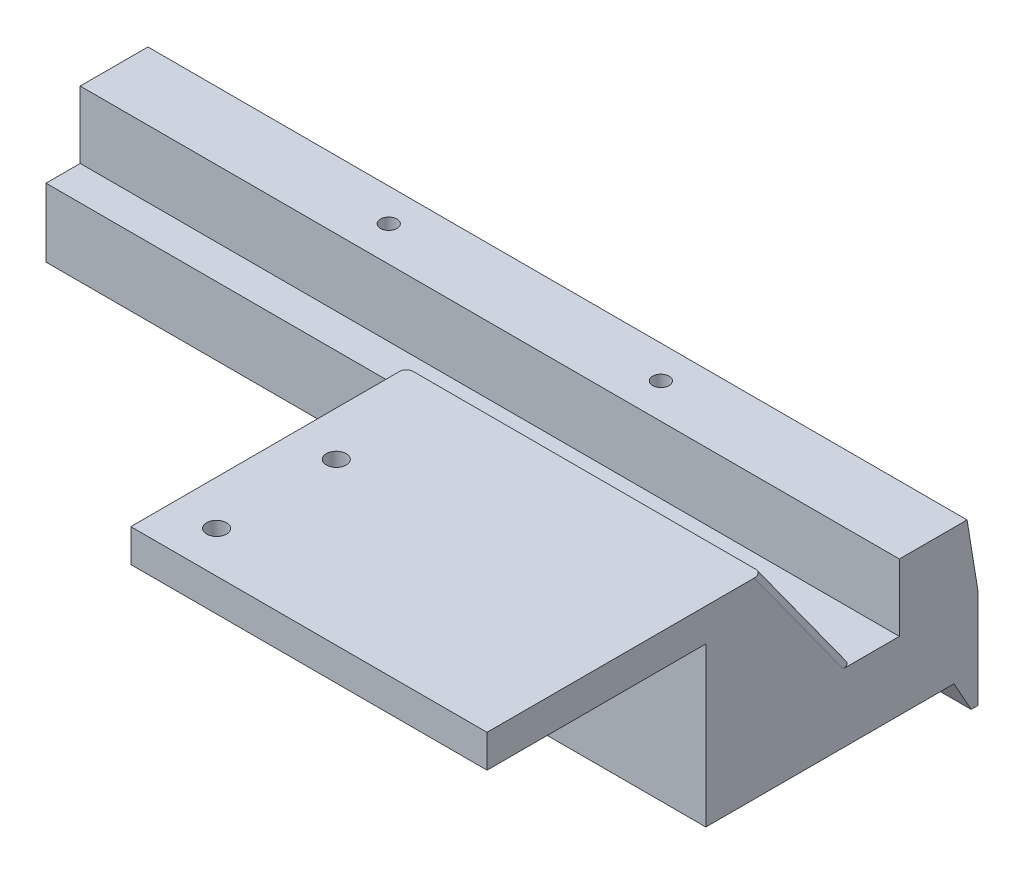
from build123d import *

# Parameters (mm, degrees)
SZKIC1_W                                             = 119.8
SZKIC1_H                                             = 10
DODANIE_WYCI_GNI_CIE2_DEPTH                          = 38.3
SZKIC21_W                                            = 119.8
SZKIC21_H                                            = 10
DODANIE_WYCI_GNI_CIE3_DEPTH                          = 9.8
POG_BIENIE_WALCOWE_POD_M2_WKR_T_DO_CZ_CI_D           = 2.4
POG_BIENIE_WALCOWE_POD_M2_WKR_T_DO_CZ_CI_CBORE_D     = 5
POG_BIENIE_WALCOWE_POD_M2_WKR_T_DO_CZ_CI_CBORE_DEPTH = 1.6
SZKIC28_R                                            = 11.1
WYTNIJ_WYCI_GNI_CIE1_DEPTH                           = 7.2
WYTNIJ_WYCI_GNI_CIE4_DEPTH                           = 124.8
DODANIE_WYCI_GNI_CIE5_DEPTH                          = 119.8
SZKIC34_W                                            = 119.8
SZKIC34_H                                            = 10
DODANIE_WYCI_GNI_CIE6_DEPTH                          = 1.5
SZKIC37_W                                            = 52.1
SZKIC37_H                                            = 8.3
DODANIE_WYCI_GNI_CIE8_DEPTH                          = 18
SZKIC38_W                                            = 52.1
SZKIC38_H                                            = 4.8
DODANIE_WYCI_GNI_CIE11_DEPTH                         = 32
ZAOKR_GLENIE5_R                                      = 0.5
SZYK_LINIOWY2_COUNT                                  = 2
SZYK_LINIOWY2_PITCH                                  = 24.2
ZAOKR_GLENIE5_OF_SZYK_LINIOWY2_R                     = 0.5
OTW_R_POD_RUB_M2_51_D                                = 2.9
EBRO7_REACH                                          = 149.637
SZKIC52_WALL_W                                       = 319.477141382
SZKIC52_WALL_H                                       = 3
ZAOKR_GLENIE7_R                                      = 1
SZYK_LINIOWY6_COUNT                                  = 5
SZYK_LINIOWY6_PITCH                                  = 12.25
ZAOKR_GLENIE7_OF_SZYK_LINIOWY6_R                     = 1
ZAOKR_GLENIE8_R                                      = 1
SZKIC53_W                                            = 67.7
SZKIC53_H                                            = 10
WYTNIJ_WYCI_GNI_CIE5_DEPTH                           = 23.3
DODANIE_WYCI_GNI_CIE12_DEPTH                         = 119.8


with BuildPart() as part:
    # Szkic1 → Dodanie-wyciągnięcie2 (new body)
    with BuildSketch(Plane.XY):
        with Locations((1.59336777, 27.024849398)):
            Rectangle(SZKIC1_W, SZKIC1_H)
    extrude(amount=DODANIE_WYCI_GNI_CIE2_DEPTH)

    # Szkic21 → Dodanie-wyciągnięcie3 (add)
    with BuildSketch(Plane(origin=(0, 32.024849398, 0), x_dir=(1, 0, 0), z_dir=(0, 1, 0))):
        with Locations((1.59336777, -5)):
            Rectangle(SZKIC21_W, SZKIC21_H)
    extrude(amount=DODANIE_WYCI_GNI_CIE3_DEPTH)

    # Pogłębienie walcowe pod M2 wkręt do części metalowych z łbem stożkowym ściętym2 (through all)
    with Locations(Plane(origin=(0, 22.024849398, 0), x_dir=(-1, 0, 0), z_dir=(0, -1, 0))):
        with Locations((-21.49336777, -4.88), (18.30663223, -4.88)):
            CounterBoreHole(POG_BIENIE_WALCOWE_POD_M2_WKR_T_DO_CZ_CI_D / 2, POG_BIENIE_WALCOWE_POD_M2_WKR_T_DO_CZ_CI_CBORE_D / 2, POG_BIENIE_WALCOWE_POD_M2_WKR_T_DO_CZ_CI_CBORE_DEPTH)

    # Szkic28 → Wytnij-wyciągnięcie1 (cut)
    with BuildSketch(Plane.XZ.offset(-22.024849398)):
        with Locations((36.49336777, 23.3)):
            Circle(SZKIC28_R)
    extrude(amount=-WYTNIJ_WYCI_GNI_CIE1_DEPTH, mode=Mode.SUBTRACT)

    # Szkic31 → Wytnij-wyciągnięcie4 (cut)
    with BuildSketch(Plane(origin=(61.49336777, 0, 0), x_dir=(0, 0, -1), z_dir=(1, 0, 0))):
        Polygon((0, 41.824849398), (-0.096491228, 41.824849398), (0, 41.232541705), align=None)
    extrude(amount=-WYTNIJ_WYCI_GNI_CIE4_DEPTH, mode=Mode.SUBTRACT)

    # Szkic31<5> → Dodanie-wyciągnięcie5 (add)
    with BuildSketch(Plane(origin=(61.49336777, 0, 0), x_dir=(0, 0, -1), z_dir=(1, 0, 0))):
        Polygon((0, 41.232541705), (0, 32.024849398), (1.5, 32.024849398), (0.275236278, 39.543014399), align=None)
    extrude(amount=-DODANIE_WYCI_GNI_CIE5_DEPTH)

    # Szkic34 → Dodanie-wyciągnięcie6 (add)
    with BuildSketch(Plane(origin=(0, 0, 0), x_dir=(-1, 0, 0), z_dir=(0, 0, -1))):
        with Locations((-1.59336777, 27.024849398)):
            Rectangle(SZKIC34_W, SZKIC34_H)
    extrude(amount=DODANIE_WYCI_GNI_CIE6_DEPTH)

    # Szkic37 → Dodanie-wyciągnięcie8 (add)
    with BuildSketch(Plane(origin=(0, 32.024849398, 0), x_dir=(1, 0, 0), z_dir=(0, 1, 0))):
        with Locations((35.44336777, -34.15)):
            Rectangle(SZKIC37_W, SZKIC37_H)
    extrude(amount=DODANIE_WYCI_GNI_CIE8_DEPTH)

    # Szkic38 → Dodanie-wyciągnięcie11 (add)
    with BuildSketch(Plane.XY.offset(38.3)):
        with Locations((35.44336777, 47.624849398)):
            Rectangle(SZKIC38_W, SZKIC38_H)
    extrude(amount=DODANIE_WYCI_GNI_CIE11_DEPTH)

    # Szkic40 → Wyciągnięcie po profilach5 section 0
    with BuildSketch(Plane.XZ.offset(-45.224849398)):
        with BuildLine():
            Line((39.018959326, 44.15), (44.018959326, 44.15))
            Line((44.018959326, 44.15), (44.018959326, 42.65))
            Line((44.018959326, 42.65), (39.018959326, 42.65))
            Line((39.018959326, 42.65), (39.018959326, 44.15))
        make_face()
    # Szkic41 → Wyciągnięcie po profilach5 section 1
    with BuildSketch(Plane(origin=(0, 43.224849398, 0), x_dir=(-1, 0, 0), z_dir=(0, -1, 0))):
        with BuildLine():
            Line((-43.490211754, -42.65), (-39.547706899, -42.65))
            Line((-39.547706899, -42.65), (-39.547706899, -44.15))
            Line((-39.547706899, -44.15), (-43.490211754, -44.15))
            Line((-43.490211754, -44.15), (-43.490211754, -42.65))
        make_face()
    wyci_gni_cie_po_profilach5 = loft()

    # Zaokrąglenie5
    zaokr_glenie5_edges = [part.edges().sort_by_distance(p)[0] for p in [
        (43.75458554, 44.224849398, 42.65),
        (43.75458554, 44.224849398, 44.15),
        (39.283333112, 44.224849398, 44.15),
        (39.283333112, 44.224849398, 42.65),
        (41.518959326, 43.224849398, 42.65),
        (41.518959326, 43.224849398, 44.15),
        (43.490211754, 43.224849398, 43.4),
        (39.547706899, 43.224849398, 43.4),
    ]]
    fillet(zaokr_glenie5_edges, radius=ZAOKR_GLENIE5_R)

    # Szyk liniowy2: Wyciągnięcie po profilach5 ×2
    with Locations(*[(0, 0, i * SZYK_LINIOWY2_PITCH) for i in range(1, SZYK_LINIOWY2_COUNT)]):
        add(wyci_gni_cie_po_profilach5)

    # Zaokrąglenie5 of Szyk liniowy2
    zaokr_glenie5_of_szyk_liniowy2_edges = [part.edges().sort_by_distance(p)[0] for p in [
        (43.75458554, 44.224849398, 66.85),
        (43.75458554, 44.224849398, 68.35),
        (39.283333112, 44.224849398, 68.35),
        (39.283333112, 44.224849398, 66.85),
        (41.518959326, 43.224849398, 66.85),
        (41.518959326, 43.224849398, 68.35),
        (43.490211754, 43.224849398, 67.6),
        (39.547706899, 43.224849398, 67.6),
    ]]
    fillet(zaokr_glenie5_of_szyk_liniowy2_edges, radius=ZAOKR_GLENIE5_OF_SZYK_LINIOWY2_R)

    # Otwór pod śrubę M2.51 (through all)
    with Locations(Plane(origin=(0, 45.224849398, 0), x_dir=(-1, 0, 0), z_dir=(0, -1, 0))):
        with Locations((-15.89336777, -46.75), (-15.89336777, -64.25)):
            Hole(OTW_R_POD_RUB_M2_51_D / 2)

    # Szkic52 wall → Żebro7 (add, up to next)
    with BuildSketch(Plane(origin=(61.49336777, 41.024849398, 23.5), x_dir=(0, -0.8106792284, -0.585490553844), z_dir=(0, 0.585490553844, -0.8106792284)), mode=Mode.PRIVATE) as ebro7_sk1:
        with Locations((0, 1.5)):
            Rectangle(SZKIC52_WALL_W, SZKIC52_WALL_H)
    ebro7_tool1 = extrude(ebro7_sk1.sketch, amount=-EBRO7_REACH, mode=Mode.PRIVATE) - part.part
    ebro7 = ebro7_tool1.solids().sort_by_distance((61.49336777, 41.024849398, 23.5))[0]
    add(ebro7)

    # Zaokrąglenie7
    zaokr_glenie7_edges = [part.edges().sort_by_distance(p)[0] for p in [
        (61.49336777, 41.024849398, 23.5),
        (58.49336777, 41.024849398, 23.5),
    ]]
    fillet(zaokr_glenie7_edges, radius=ZAOKR_GLENIE7_R)

    # Szyk liniowy6: Żebro7 ×5
    with Locations(*[(-i * SZYK_LINIOWY6_PITCH, 0, 0) for i in range(1, SZYK_LINIOWY6_COUNT)]):
        add(ebro7)

    # Zaokrąglenie7 of Szyk liniowy6
    zaokr_glenie7_of_szyk_liniowy6_edges = [part.edges().sort_by_distance(p)[0] for p in [
        (49.24336777, 41.024849398, 23.5),
        (46.24336777, 41.024849398, 23.5),
        (36.99336777, 41.024849398, 23.5),
        (33.99336777, 41.024849398, 23.5),
        (24.74336777, 41.024849398, 23.5),
        (21.74336777, 41.024849398, 23.5),
        (12.49336777, 41.024849398, 23.5),
        (9.49336777, 41.024849398, 23.5),
    ]]
    fillet(zaokr_glenie7_of_szyk_liniowy6_edges, radius=ZAOKR_GLENIE7_OF_SZYK_LINIOWY6_R)

    # Zaokrąglenie8
    zaokr_glenie8_edges = [part.edges().sort_by_distance(p)[0] for p in [
        (9.39336777, 41.024849398, 30),
    ]]
    fillet(zaokr_glenie8_edges, radius=ZAOKR_GLENIE8_R)

    # Szkic53 → Wytnij-wyciągnięcie5 (cut)
    with BuildSketch(Plane.XY.offset(38.3)):
        with Locations((-24.45663223, 27.024849398)):
            Rectangle(SZKIC53_W, SZKIC53_H)
    extrude(amount=-WYTNIJ_WYCI_GNI_CIE5_DEPTH, mode=Mode.SUBTRACT)

    # Szkic54 → Dodanie-wyciągnięcie12 (add)
    with BuildSketch(Plane(origin=(61.49336777, 0, 0), x_dir=(0, 0, -1), z_dir=(1, 0, 0))):
        Polygon((-2, 22.024849398), (1.5, 22.024849398), (1.5, 17.524849398), (0.5, 17.524849398), align=None)
    extrude(amount=-DODANIE_WYCI_GNI_CIE12_DEPTH)


solid = part.part
